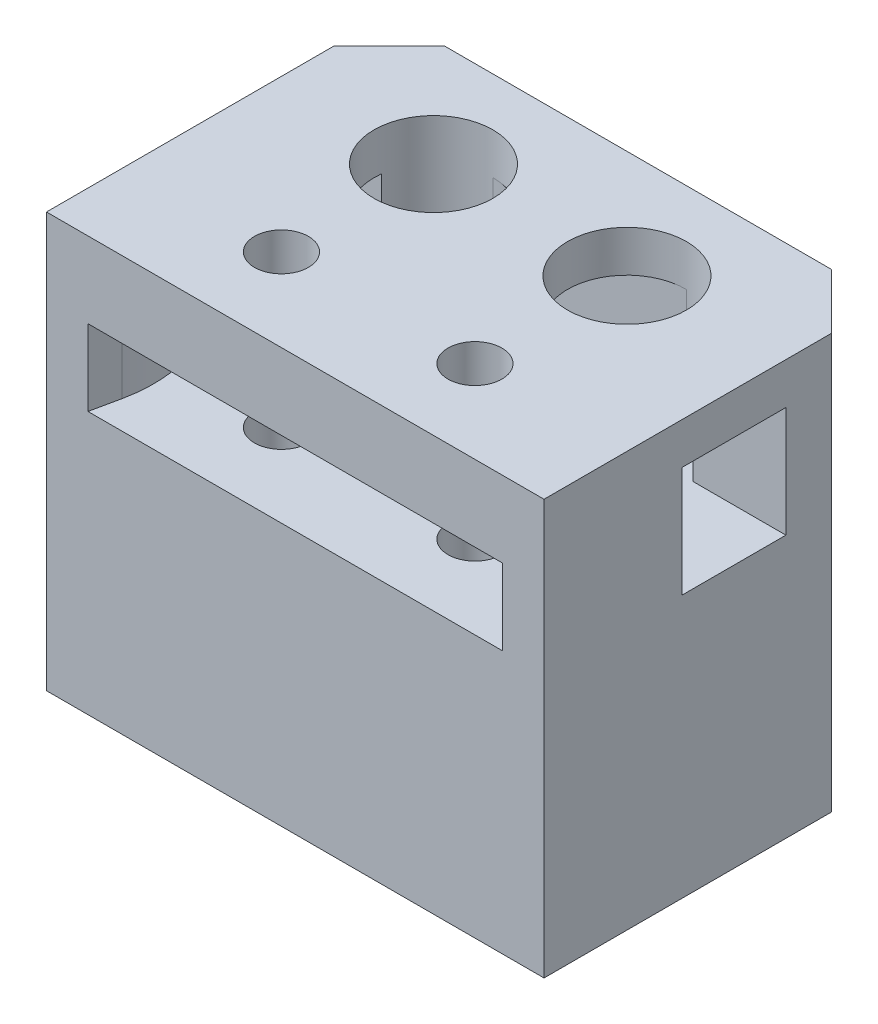
from build123d import *
from OCP.BRepFilletAPI import BRepFilletAPI_MakeChamfer

# Parameters (mm, degrees)
BOSS_EXTRUDE1_DEPTH             = 30
CUT_EXTRUDE2_DEPTH              = 5.5
CBORE_FOR_M4_SBHCS1_D           = 4.5
CBORE_FOR_M4_SBHCS1_CBORE_D     = 8.6
CBORE_FOR_M4_SBHCS1_CBORE_DEPTH = 8
F_3_9_3_9_DIAMETER_HOLE1_D      = 3.9
CUT_EXTRUDE3_DEPTH              = 43.884029661
CUT_EXTRUDE3_DEPTH_BACK         = 43.884029661
SKETCH9_W                       = 7.5
SKETCH9_H                       = 8
CHAMFER1_SIZE                   = 4
CHAMFER1_SIZE2                  = 3.37362922
DELETEFACE1_START               = 24.5
DELETEFACE1_DEPTH               = 2.5
DELETEFACE2_START               = 19
DELETEFACE2_DEPTH               = 5.5
FILLET1_R                       = 10


# Read off the part's stored shape, not the designer's step: DeleteFace1, DeleteFace2
with BuildPart() as part:
    # Sketch1 → Boss-Extrude1 (new body)
    with BuildSketch(Plane(origin=(0, 0, 0), x_dir=(1, 0, 0), z_dir=(0, 1, 0))):
        Polygon((-18, 0), (18, 0), (18, 20.8), (14, 24.8), (-14, 24.8), (-18, 20.8), align=None)
    extrude(amount=BOSS_EXTRUDE1_DEPTH)

    # Sketch7 → Cut-Extrude2 (cut)
    with BuildSketch(Plane(origin=(0, 19, 0), x_dir=(1, 0, 0), z_dir=(0, 1, 0))):
        with BuildLine():
            Line((-7, 21.3), (7, 21.3))
            ThreePointArc((7, 21.3), (9.706928791, 20.34103824), (11.206489583, 17.891877451))
            Line((11.206489583, 17.891877451), (15, 0))
            Line((15, 0), (-15, 0))
            Line((-15, 0), (-11.206489583, 17.891877451))
            ThreePointArc((-11.206489583, 17.891877451), (-9.706928791, 20.34103824), (-7, 21.3))
        make_face()
    extrude(amount=CUT_EXTRUDE2_DEPTH, mode=Mode.SUBTRACT)

    # CBORE for M4 SBHCS1 (through all)
    with Locations(Plane(origin=(0, 30, 0), x_dir=(1, 0, 0), z_dir=(0, 1, 0))):
        with Locations((-7, 17), (7, 17)):
            CounterBoreHole(CBORE_FOR_M4_SBHCS1_D / 2, CBORE_FOR_M4_SBHCS1_CBORE_D / 2, CBORE_FOR_M4_SBHCS1_CBORE_DEPTH)

    # Ø3.9 (3.9) Diameter Hole1 (through all)
    with Locations(Plane(origin=(0, 30, 0), x_dir=(1, 0, 0), z_dir=(0, 1, 0))):
        with Locations((-7, 6), (7, 6)):
            Hole(F_3_9_3_9_DIAMETER_HOLE1_D / 2)

    # Sketch9 → Cut-Extrude3 (cut, two sides: drawn at the far end of the back side and taken through both)
    with BuildSketch(Plane(origin=(0, 0, 0), x_dir=(0, 0, -1), z_dir=(1, 0, 0)).offset(-CUT_EXTRUDE3_DEPTH_BACK)):
        with Locations((13.75, 23)):
            Rectangle(SKETCH9_W, SKETCH9_H)
    extrude(amount=CUT_EXTRUDE3_DEPTH + CUT_EXTRUDE3_DEPTH_BACK, mode=Mode.SUBTRACT)

    # Chamfer1: one chamfer whose edges measure the first distance from different faces: ONE call of the kernel's chamfer builder (chamfer() names one face for all edges)
    chamfer1_edges_1 = [part.edges().sort_by_distance(p)[0] for p in [
        (-12.879758328, 21.75, -10),
    ]]
    chamfer1_side_1 = [part.faces().sort_by_distance(p)[0] for p in [
        (-13.939879164, 21.75, -5),
    ]]
    chamfer1_edges_2 = [part.edges().sort_by_distance(p)[0] for p in [
        (12.879758328, 21.75, -10),
    ]]
    chamfer1_side_2 = [part.faces().sort_by_distance(p)[0] for p in [
        (13.939879164, 21.75, -5),
    ]]
    chamfer1 = BRepFilletAPI_MakeChamfer(part.part.solid().wrapped)
    for e in chamfer1_edges_1:
        chamfer1.Add(CHAMFER1_SIZE, CHAMFER1_SIZE2, e.wrapped, chamfer1_side_1[0].wrapped)  # the first distance lies on this face
    for e in chamfer1_edges_2:
        chamfer1.Add(CHAMFER1_SIZE, CHAMFER1_SIZE2, e.wrapped, chamfer1_side_2[0].wrapped)  # the first distance lies on this face
    add(Compound.cast(chamfer1.Shape()), mode=Mode.REPLACE)

    # DeleteFace1 outline → DeleteFace1 (cut)
    with BuildSketch(Plane(origin=(0, 0, 0), x_dir=(1, 0, 0), z_dir=(0, 1, 0)).offset(DELETEFACE1_START)):
        with BuildLine():
            Line((7, 21.3), (-7, 21.3))
            ThreePointArc((-7, 21.3), (-4.141678814, 20.212475681), (-2.729168699, 17.5))
            Line((-2.729168699, 17.5), (2.729168699, 17.5))
            ThreePointArc((2.729168699, 17.5), (4.141678814, 20.212475681), (7, 21.3))
        make_face()
    extrude(amount=DELETEFACE1_DEPTH, mode=Mode.SUBTRACT)

    # DeleteFace2 outline → DeleteFace2 (add)
    with BuildSketch(Plane(origin=(0, 0, 0), x_dir=(1, 0, 0), z_dir=(0, 1, 0)).offset(DELETEFACE2_START)):
        with BuildLine():
            Line((-11.206489583, 17.891877451), (-11.289577073, 17.5))
            Line((-11.289577073, 17.5), (-11.270831301, 17.5))
            ThreePointArc((-11.270831301, 17.5), (-11.243186813, 17.696681903), (-11.206489583, 17.891877451))
        make_face()
        with BuildLine():
            Line((11.289577073, 17.5), (11.206489583, 17.891877451))
            ThreePointArc((11.206489583, 17.891877451), (11.243186813, 17.696681903), (11.270831301, 17.5))
            Line((11.270831301, 17.5), (11.289577073, 17.5))
        make_face()
    extrude(amount=DELETEFACE2_DEPTH)

    # Fillet1
    fillet1_edges = [part.edges().sort_by_distance(p)[0] for p in [
        (-13.70941177, 21.75, -6.086986434),
        (13.70941177, 21.75, -6.086986434),
    ]]
    fillet(fillet1_edges, radius=FILLET1_R)


solid = part.part
